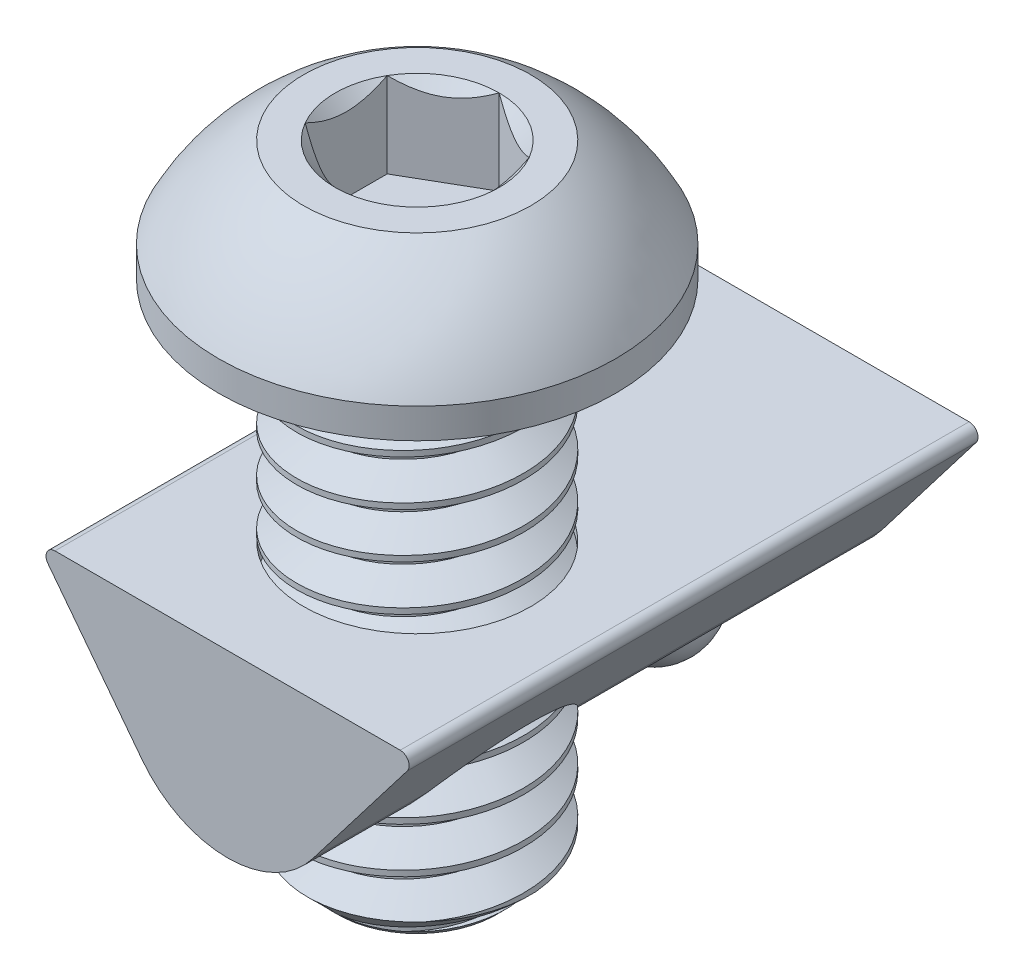
from build123d import *

# Parameters (mm, degrees)
SKETCH1_R           = 3.175
BOSS_EXTRUDE1_DEPTH = 14.2875
CUT_SWEEP1_PITCH    = 1.27
SKETCH4_OUTSIDE_W   = 14.266
SKETCH4_OUTSIDE_H   = 14.266
SKETCH4_OUTSIDE_R   = 2.21262927
CUT_EXTRUDE1_DEPTH  = 1.27
CUT_EXTRUDE1_DRAFT  = -45
CUT_EXTRUDE2_DEPTH  = 2.38125
BOSS_EXTRUDE2_START = 5.3
BOSS_EXTRUDE2_DEPTH = 15.9
SKETCH9_R           = 3.175
CUT_EXTRUDE4_DEPTH  = 19.63582706


with BuildPart() as part:
    # Sketch1 → Boss-Extrude1 (new body)
    with BuildSketch(Plane(origin=(0, 0, 0), x_dir=(1, 0, 0), z_dir=(0, 1, 0))):
        with Locations(Location((0, 0, 0), (0, 0, 270))):
            Circle(SKETCH1_R)
    extrude(amount=-BOSS_EXTRUDE1_DEPTH)

    # Cut-Sweep1: the profile of Sketch3 screwed along a right-hand helix of 12.25 turns, 8 arcs to a turn; built about Z, then put on its axis
    cut_sweep1_z = Axis((0, 0, 0), (0, 0, 1))
    cut_sweep1_corners = [(2.350110803, 0, -0.47625), (3.243740766, 0, 0.0396875), (3.243740766, 0, -1.1509375), (2.350110803, 0, -0.635)]
    with BuildLine(mode=Mode.PRIVATE) as cut_sweep1_profile:
        Line(cut_sweep1_corners[0], cut_sweep1_corners[1])
        Line(cut_sweep1_corners[1], cut_sweep1_corners[2])
        Line(cut_sweep1_corners[2], cut_sweep1_corners[3])
        Line(cut_sweep1_corners[3], cut_sweep1_corners[0])
    cut_sweep1_cap = Face(cut_sweep1_profile.wire())
    cut_sweep1_turn_angles = [0, 22.5, 45, 67.5, 90, 112.5, 135, 157.5, 180, 202.5, 225, 247.5, 270, 292.5, 315, 337.5, 360]
    cut_sweep1_turn_weights = [1, 0.9238795325112867, 1, 0.9238795325112867, 1, 0.9238795325112867, 1, 0.9238795325112867, 1, 0.9238795325112867, 1, 0.9238795325112867, 1, 0.9238795325112867, 1, 0.9238795325112867, 1]
    cut_sweep1_turn_rails = [Edge.make_bspline([Vector(p[0], p[1], 0).rotate(cut_sweep1_z, cut_sweep1_turn_angles[k]) / cut_sweep1_turn_weights[k] + Vector(0, 0, p[2] + CUT_SWEEP1_PITCH * cut_sweep1_turn_angles[k] / 360) for k in range(17)], [0, 0, 0, 1, 1, 2, 2, 3, 3, 4, 4, 5, 5, 6, 6, 7, 7, 8, 8, 8], 2, cut_sweep1_turn_weights) for p in cut_sweep1_corners]
    cut_sweep1_turn_sides = [Face.make_surface_from_curves(cut_sweep1_turn_rails[p[0]], cut_sweep1_turn_rails[p[1]]) for p in [(0, 1), (1, 2), (2, 3), (3, 0)]]
    cut_sweep1_last_angles = [4320, 4342.5, 4365, 4387.5, 4410]
    cut_sweep1_last_weights = [1, 0.9238795325112867, 1, 0.9238795325111987, 1]
    cut_sweep1_last_rails = [Edge.make_bspline([Vector(p[0], p[1], 0).rotate(cut_sweep1_z, cut_sweep1_last_angles[k]) / cut_sweep1_last_weights[k] + Vector(0, 0, p[2] + CUT_SWEEP1_PITCH * cut_sweep1_last_angles[k] / 360) for k in range(5)], [0, 0, 0, 1, 1, 2, 2, 2], 2, cut_sweep1_last_weights) for p in cut_sweep1_corners]
    cut_sweep1_last_sides = [Face.make_surface_from_curves(cut_sweep1_last_rails[p[0]], cut_sweep1_last_rails[p[1]]) for p in [(0, 1), (1, 2), (2, 3), (3, 0)]]
    cut_sweep1 = Plane(origin=(0, -14.2875, 0), x_dir=(0, 0, -1), z_dir=(0, 1, 0)) * Solid(Shell([*[p.moved(Location((0, 0, CUT_SWEEP1_PITCH * i))) for i in range(12) for p in cut_sweep1_turn_sides], *cut_sweep1_last_sides, cut_sweep1_cap, cut_sweep1_cap.rotate(cut_sweep1_z, 4410).moved(Location((0, 0, CUT_SWEEP1_PITCH * 4410 / 360)))]))
    add(cut_sweep1, mode=Mode.SUBTRACT)


with BuildPart() as cut_extrude1_tool:
    # Sketch4 outside → Cut-Extrude1 (with draft: the straight prism first)
    with BuildSketch(Plane.XZ.offset(14.2875)):
        Rectangle(SKETCH4_OUTSIDE_W, SKETCH4_OUTSIDE_H)
        Circle(SKETCH4_OUTSIDE_R, mode=Mode.SUBTRACT)
    extrude(amount=-CUT_EXTRUDE1_DEPTH)
    # Cut-Extrude1: the draft: its side faces are tilted about the plane it starts from
    cut_extrude1_sides = [cut_extrude1_tool.faces().sort_by_distance(p)[0] for p in [
        (0, -13.6525, -7.133),
        (7.133, -13.6525, 0),
        (0, -13.6525, 7.133),
        (-7.133, -13.6525, 0),
        (-2.21262927, -13.6525, 0),
    ]]
    draft(cut_extrude1_sides, Plane.XZ.offset(14.2875), CUT_EXTRUDE1_DRAFT)


with BuildPart() as part_1:
    add(part.part)

    # Cut-Extrude1: cut by cut_extrude1_tool
    add(cut_extrude1_tool.part, mode=Mode.SUBTRACT)

    # Sketch5 → Revolve1 (revolve)
    with BuildSketch(Plane.XY, mode=Mode.PRIVATE) as revolve1_sk:
        with BuildLine():
            Line((0, 3.3528), (0, 0))
            Line((0, 0), (-5.5499, 0))
            Line((-5.5499, 0), (-5.5499, 0.8382))
            ThreePointArc((-5.5499, 0.8382), (-4.540019085, 2.263204136), (-3.175, 3.3528))
            Line((-3.175, 3.3528), (0, 3.3528))
        make_face()
    revolve(revolve1_sk.sketch.rotate(Axis((0, 0, 0), (0, -1, 0)), 90), axis=Axis((0, 0, 0), (0, -1, 0)))

    # Sketch6 → Cut-Extrude2 (cut)
    with BuildSketch(Plane(origin=(0, 3.3528, 0), x_dir=(1, 0, 0), z_dir=(0, 1, 0))):
        Polygon((0, 2.291358881), (-1.984375, 1.14567944), (-1.984375, -1.14567944), (0, -2.291358881), (1.984375, -1.14567944), (1.984375, 1.14567944), align=None)
    extrude(amount=-CUT_EXTRUDE2_DEPTH, mode=Mode.SUBTRACT)

    # Cut-Extrude3 cone 1 section (through the dimple's axis) → Cut-Extrude3 (revolve, cut)
    with BuildSketch(Plane(origin=(0, 3.3528, 0), x_dir=(0, 0, 1), z_dir=(1, 0, 0))):
        Polygon((0, 0), (2.291358881, 0), (0, 2.291358881), align=None)
    revolve(axis=Axis((0, 3.3528, 0), (0, -1, 0)), mode=Mode.SUBTRACT)


with BuildPart() as body_2:
    # Sketch8 → Boss-Extrude2 (new body)
    with BuildSketch(Plane.XY.offset(BOSS_EXTRUDE2_START)):
        with BuildLine():
            Line((-5.023338335, -6.752190357), (-2.380060021, -10.196977724))
            ThreePointArc((-2.380060021, -10.196977724), (0, -11.370693437), (2.380060021, -10.196977724))
            Line((2.380060021, -10.196977724), (5.023338335, -6.752190357))
            ThreePointArc((5.023338335, -6.752190357), (5.049218185, -6.489427827), (4.825, -6.35))
            Line((4.825, -6.35), (-4.825, -6.35))
            ThreePointArc((-4.825, -6.35), (-5.049218185, -6.489427827), (-5.023338335, -6.752190357))
        make_face()
    extrude(amount=-BOSS_EXTRUDE2_DEPTH)

    # Sketch9 → Cut-Extrude4 (cut, through all)
    with BuildSketch(Plane(origin=(0, 0, 0), x_dir=(1, 0, 0), z_dir=(0, 1, 0))):
        with Locations(Location((0, 0, 0), (0, 0, 221.44207772))):
            Circle(SKETCH9_R)
    extrude(amount=-CUT_EXTRUDE4_DEPTH, mode=Mode.SUBTRACT)

    # Sketch10 → Cut-Revolve1 (revolve, cut)
    with BuildSketch(Plane(origin=(0, 0, 0), x_dir=(0, 0, -1), z_dir=(1, 0, 0))):
        Polygon((6.6, -6.6), (6.6, -11.370693437), (5.1, -11.370693437), (5.1, -7.35), (6.399038106, -6.6), align=None)
    revolve(axis=Axis((0, -6.35, -6.6), (0, -1, 0)), mode=Mode.SUBTRACT)


with BuildPart() as body_3:
    # Sketch11 → Revolve2 (revolve)
    with BuildSketch(Plane(origin=(0, 0, 0), x_dir=(0, 0, -1), z_dir=(1, 0, 0))):
        with BuildLine():
            Line((6.6, -9.370693437), (6.6, -12.370693437))
            ThreePointArc((6.6, -12.370693437), (5.1, -10.870693437), (6.6, -9.370693437))
        make_face()
    revolve(axis=Axis((0, -9.370693437, -6.6), (0, -1, 0)))


solid = Compound([part_1.part, body_2.part, body_3.part])
